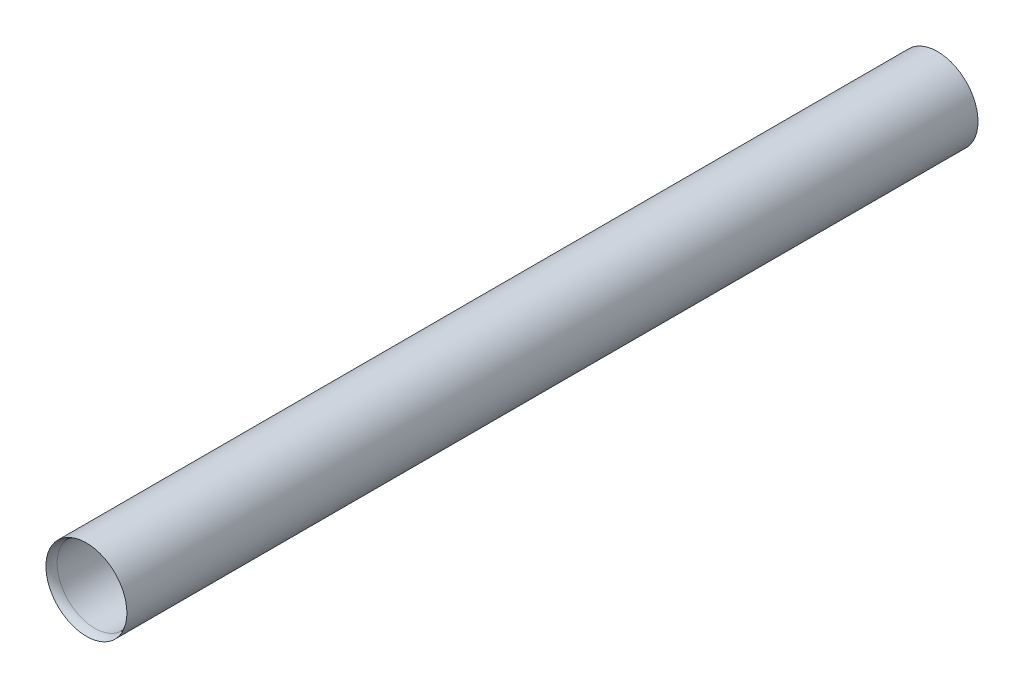
from build123d import *

# Parameters (mm, degrees)
SKETCH1_R           = 14.5
BOSS_EXTRUDE1_DEPTH = 304.8
SKETCH2_R           = 13.5
CUT_EXTRUDE1_DEPTH  = 304.8
FILLET3_R           = 5


with BuildPart() as part:
    # Sketch1 → Boss-Extrude1 (new body)
    with BuildSketch(Plane.XY):
        Circle(SKETCH1_R)
    extrude(amount=-BOSS_EXTRUDE1_DEPTH)

    # Sketch2 → Cut-Extrude1 (cut)
    with BuildSketch(Plane.XY):
        Circle(SKETCH2_R)
    extrude(amount=-CUT_EXTRUDE1_DEPTH, mode=Mode.SUBTRACT)

    # Fillet3
    # the kernel refuses this fillet: 5 mm, written as the material it takes off along each edge
    with BuildSketch(Plane(origin=(0, 0, 0), x_dir=(1, 0, 0), z_dir=(0, -1, 0))) as fillet3_piece_1:
        with BuildLine():
            CenterArc((18.5, -3), FILLET3_R, 143.130102354, 36.869897646)
            Line((13.5, -3), (13.4, -3))
            Line((13.4, -3), (13.4, 0))
            Line((13.4, 0), (13.5, 0.1))
            ThreePointArc((13.5, 0.1), (14, 0.1), (14.42, 0.06))
            Line((14.42, 0.06), (14.5, 0))
        make_face()
    revolve(axis=Axis((0, 0, 0), (0, 0, 1)), mode=Mode.SUBTRACT)


solid = part.part
